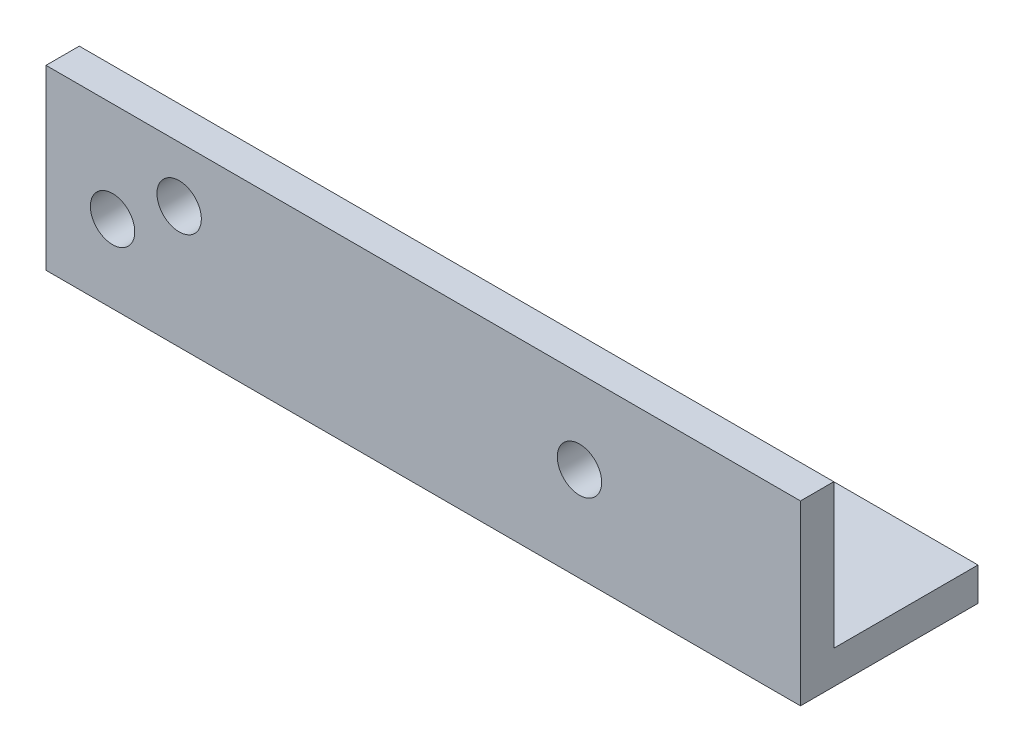
from build123d import *

# Parameters (mm, degrees)
BOSS_EXTRUDE1_DEPTH = 107.95
CUT_EXTRUDE1_REACH  = 114.802
SKETCH3_R           = 3.175
CUT_EXTRUDE2_REACH  = 115.77
SKETCH4_R           = 3.175


with BuildPart() as part:
    # Sketch1 → Boss-Extrude1 (new body)
    with BuildSketch(Plane(origin=(0, 0, 0), x_dir=(0, 0, -1), z_dir=(1, 0, 0))):
        Polygon((0, 0), (0, -25.4), (25.4, -25.4), (25.4, -20.6375), (4.7625, -20.6375), (4.7625, 0), align=None)
    extrude(amount=BOSS_EXTRUDE1_DEPTH)

    # Sketch3 → Cut-Extrude1 (cut, up to next)
    with BuildSketch(Plane(origin=(0, 0, -4.7625), x_dir=(-1, 0, 0), z_dir=(0, 0, -1)), mode=Mode.PRIVATE) as cut_extrude1_sk1:
        with Locations((-9.525, -14.2875)):
            Circle(SKETCH3_R)
    cut_extrude1_tool1 = extrude(cut_extrude1_sk1.sketch, amount=-CUT_EXTRUDE1_REACH, mode=Mode.PRIVATE) & part.part
    # Sketch3 → Cut-Extrude1 (cut, up to next)
    with BuildSketch(Plane(origin=(0, 0, -4.7625), x_dir=(-1, 0, 0), z_dir=(0, 0, -1)), mode=Mode.PRIVATE) as cut_extrude1_sk2:
        with Locations((-19.05, -7.9375)):
            Circle(SKETCH3_R)
    cut_extrude1_tool2 = extrude(cut_extrude1_sk2.sketch, amount=-CUT_EXTRUDE1_REACH, mode=Mode.PRIVATE) & part.part
    add(cut_extrude1_tool1.solids().sort_by_distance((9.525, -14.2875, -4.7625))[0], mode=Mode.SUBTRACT)
    add(cut_extrude1_tool2.solids().sort_by_distance((19.05, -7.9375, -4.7625))[0], mode=Mode.SUBTRACT)

    # Sketch4 → Cut-Extrude2 (cut, up to next)
    with BuildSketch(Plane.XY, mode=Mode.PRIVATE) as cut_extrude2_sk1:
        with Locations((76.332177029, -11.929615818)):
            Circle(SKETCH4_R)
    cut_extrude2_tool1 = extrude(cut_extrude2_sk1.sketch, amount=-CUT_EXTRUDE2_REACH, mode=Mode.PRIVATE) & part.part
    add(cut_extrude2_tool1.solids().sort_by_distance((76.332177, -11.929616, 0))[0], mode=Mode.SUBTRACT)


solid = part.part
